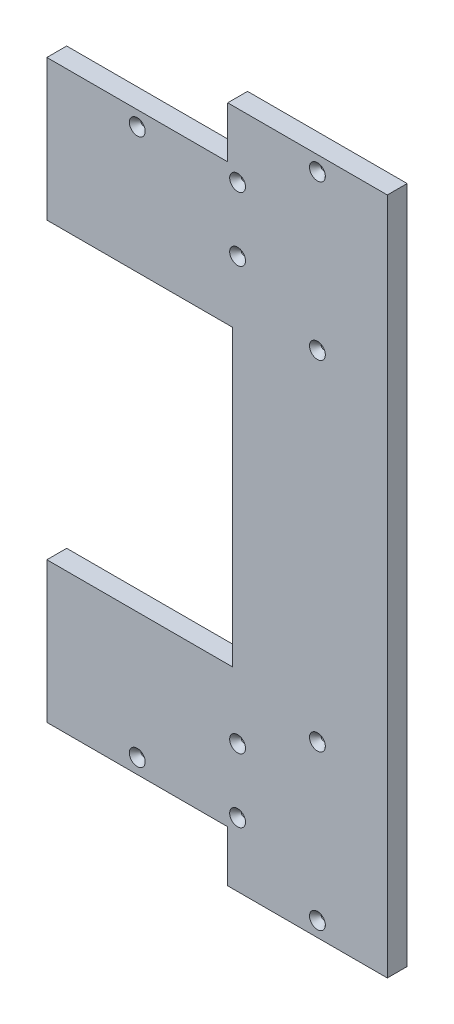
from build123d import *

# Parameters (mm, degrees)
SKETCH1_W           = 243.588796282
SKETCH1_H           = 434.599999988
BOSS_EXTRUDE1_DEPTH = 12.7
CUT_EXTRUDE1_REACH  = 273.182
SKETCH2_W           = 141.287862113
SKETCH2_H           = 32.775
CUT_EXTRUDE2_REACH  = 273.182
HOLE1_D             = 3.175
HOLE1_DEPTH         = 38.1
HOLE1_CSINK_D       = 10.16
HOLE1_CSINK_ANGLE   = 82
HOLE1_TIP           = 0.953866233


with BuildPart() as part:
    # Sketch1 → Boss-Extrude1 (new body)
    with BuildSketch(Plane.XY):
        with Locations((39.942597436, 0)):
            Rectangle(SKETCH1_W, SKETCH1_H)
    extrude(amount=BOSS_EXTRUDE1_DEPTH)

    # Sketch2 → Cut-Extrude1 (cut, up to next)
    with BuildSketch(Plane(origin=(0, 0, 0), x_dir=(-1, 0, 0), z_dir=(0, 0, -1)), mode=Mode.PRIVATE) as cut_extrude1_sk1:
        with Locations((11.207869649, 200.912499994)):
            Rectangle(SKETCH2_W, SKETCH2_H)
    cut_extrude1_tool1 = extrude(cut_extrude1_sk1.sketch, amount=-CUT_EXTRUDE1_REACH, mode=Mode.PRIVATE) & part.part
    # Sketch2 → Cut-Extrude1 (cut, up to next)
    with BuildSketch(Plane(origin=(0, 0, 0), x_dir=(-1, 0, 0), z_dir=(0, 0, -1)), mode=Mode.PRIVATE) as cut_extrude1_sk2:
        with Locations((11.207869649, -200.912499994)):
            Rectangle(SKETCH2_W, SKETCH2_H)
    cut_extrude1_tool2 = extrude(cut_extrude1_sk2.sketch, amount=-CUT_EXTRUDE1_REACH, mode=Mode.PRIVATE) & part.part
    add(cut_extrude1_tool1.solids().sort_by_distance((-11.20787, 200.9125, 0))[0], mode=Mode.SUBTRACT)
    add(cut_extrude1_tool2.solids().sort_by_distance((-11.20787, -200.9125, 0))[0], mode=Mode.SUBTRACT)

    # Sketch3 → Cut-Extrude2 (cut, up to next)
    with BuildSketch(Plane.XY.offset(12.7), mode=Mode.PRIVATE) as cut_extrude2_sk1:
        Polygon((62.611061408, 94.249999997), (-56.451800705, 94.249999997), (-56.451800705, 184.524999994), (-81.851800705, 184.524999994), (-81.851800705, 94.249999997), (-85.026800705, 94.249999997), (-85.026800705, -94.249999997), (-81.851800705, -94.249999997), (-81.851800705, -184.524999994), (-56.451800705, -184.524999994), (-56.451800705, -94.249999997), (62.611061408, -94.249999997), align=None)
    cut_extrude2_tool1 = extrude(cut_extrude2_sk1.sketch, amount=-CUT_EXTRUDE2_REACH, mode=Mode.PRIVATE) & part.part
    add(cut_extrude2_tool1.solids().sort_by_distance((-19.405412, 0, 12.7))[0], mode=Mode.SUBTRACT)

    # Hole1
    with Locations(Plane(origin=(449.828463103, 0, 12.7), x_dir=(0, 1, 0), z_dir=(0, 0, 1))):
        with Locations((-108.649999997, 332.89193461), (108.649999997, 332.89193461), (207.774999994, 332.89193461), (174.999999994, 448.336332751), (135.266666663, 384.042401694), (176.283333328, 384.042401694), (-174.999999994, 448.336332751), (-135.266666663, 384.042401694), (-176.283333328, 384.042401694), (-207.774999994, 332.89193461)):
            CounterSinkHole(HOLE1_D / 2, HOLE1_CSINK_D / 2, depth=HOLE1_DEPTH, counter_sink_angle=HOLE1_CSINK_ANGLE)
            with Locations((0, 0, -(HOLE1_DEPTH + HOLE1_TIP / 2))):  # 118° drill point
                Cone(0, HOLE1_D / 2, HOLE1_TIP, mode=Mode.SUBTRACT)


solid = part.part
